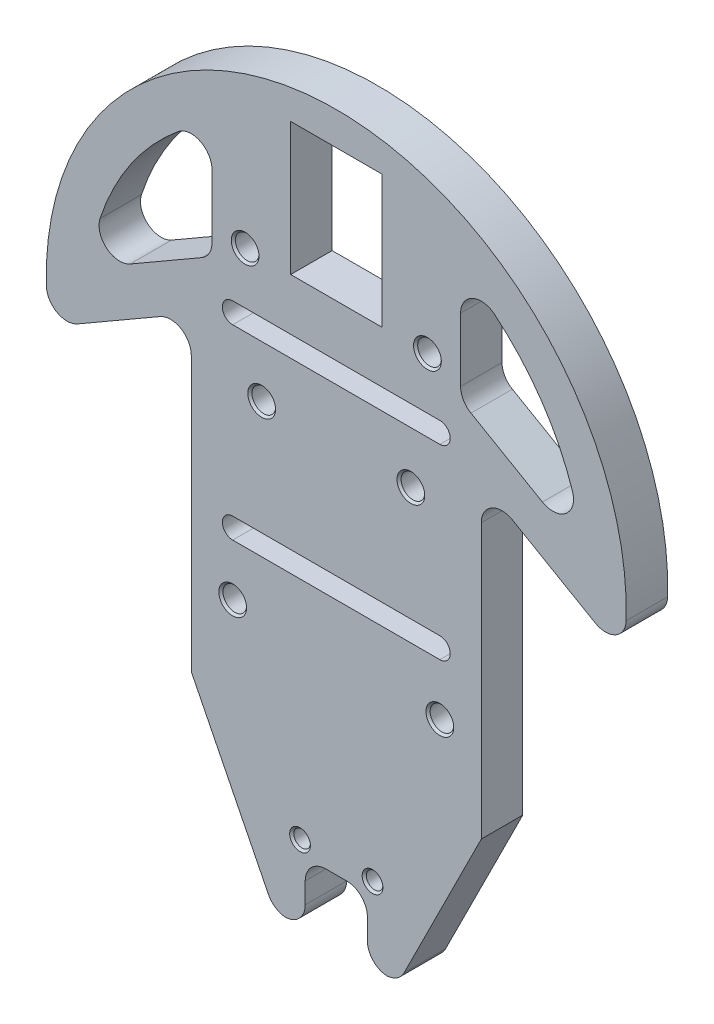
from build123d import *

# Parameters (mm, degrees)
SKETCH4_R           = 2
SKETCH4_R_2         = 2.85
SKETCH4_W           = 22
SKETCH4_H           = 32
BOSS_EXTRUDE1_DEPTH = 5
FILLET1_R           = 5
CHAMFER1_SIZE       = 0.5


with BuildPart() as part:
    # Sketch4 → Boss-Extrude1 (new, symmetric)
    with BuildSketch(Plane.XY):
        with BuildLine():
            ThreePointArc((69.282032303, -10), (0, 70), (-69.282032303, -10))
            Line((-69.282032303, -10), (-35, 9.792740578))
            Line((-35, 9.792740578), (-35, -55))
            Line((-35, -55), (-35, -65))
            Line((-35, -65), (-15, -105))
            Line((-15, -105), (-7.5, -105))
            Line((-7.5, -105), (-7.5, -90))
            Line((-7.5, -90), (7.5, -90))
            Line((7.5, -90), (7.5, -105))
            Line((7.5, -105), (15, -105))
            Line((15, -105), (35, -65))
            Line((35, -65), (35, 9.792740578))
            Line((35, 9.792740578), (69.282032303, -10))
        make_face()
        with Locations((-8.75, -87)):
            Circle(SKETCH4_R, mode=Mode.SUBTRACT)
        with Locations((-25, -45)):
            Circle(SKETCH4_R_2, mode=Mode.SUBTRACT)
        with Locations((8.75, -87)):
            Circle(SKETCH4_R, mode=Mode.SUBTRACT)
        with Locations((25, -45)):
            Circle(SKETCH4_R_2, mode=Mode.SUBTRACT)
        with BuildLine():
            Line((25, -32.5), (-25, -32.5))
            ThreePointArc((-25, -32.5), (-27.5, -30), (-25, -27.5))
            Line((-25, -27.5), (25, -27.5))
            ThreePointArc((25, -27.5), (27.5, -30), (25, -32.5))
        make_face(mode=Mode.SUBTRACT)
        with Locations((-18, 0)):
            Circle(SKETCH4_R_2, mode=Mode.SUBTRACT)
        with BuildLine():
            Line((-30, 24.226497308), (-59.572090597, 7.153042841))
            ThreePointArc((-59.572090597, 7.153042841), (-50.077338732, 33.04935923), (-30, 51.961524227))
            Line((-30, 51.961524227), (-30, 24.226497308))
        make_face(mode=Mode.SUBTRACT)
        with Locations((-22, 30)):
            Circle(SKETCH4_R_2, mode=Mode.SUBTRACT)
        with Locations((0, 46)):
            Rectangle(SKETCH4_W, SKETCH4_H, mode=Mode.SUBTRACT)
        with Locations((18, 0)):
            Circle(SKETCH4_R_2, mode=Mode.SUBTRACT)
        with BuildLine():
            Line((25, 12.5), (-25, 12.5))
            ThreePointArc((-25, 12.5), (-27.5, 15), (-25, 17.5))
            Line((-25, 17.5), (25, 17.5))
            ThreePointArc((25, 17.5), (27.5, 15), (25, 12.5))
        make_face(mode=Mode.SUBTRACT)
        with Locations((22, 30)):
            Circle(SKETCH4_R_2, mode=Mode.SUBTRACT)
        with BuildLine():
            Line((59.572090597, 7.153042841), (30, 24.226497308))
            Line((30, 24.226497308), (30, 51.961524227))
            ThreePointArc((30, 51.961524227), (50.077338732, 33.04935923), (59.572090597, 7.153042841))
        make_face(mode=Mode.SUBTRACT)
    extrude(amount=BOSS_EXTRUDE1_DEPTH, both=True)

    # Fillet1
    # the kernel refuses this fillet: 5 mm, written as the material it adds along each edge
    with BuildSketch(Plane(origin=(59.572090597, 7.153042841, -5), x_dir=(-0.8660254037844397, 0.49999999999999806, 0), z_dir=(0, 0, 1))) as fillet1_piece_1:
        with BuildLine():
            CenterArc((11.332313176, -5), FILLET1_R, 90, 138.168098297)
            ThreePointArc((7.997575975, -8.725523829), (3.783101322, -4.560454399), (0, 0))
            Line((0, 0), (11.332313176, 0))
        make_face()
    extrude(amount=10)
    with BuildSketch(Plane(origin=(30, 24.226497308, 5), x_dir=(0, 1, 0), z_dir=(0, 0, -1))) as fillet1_piece_2:
        with BuildLine():
            CenterArc((FILLET1_R * 0.57735026919, FILLET1_R), FILLET1_R, 210, 60)
            Line((-FILLET1_R * 0.288675134595, FILLET1_R * 0.5), (0, 0))
            Line((0, 0), (FILLET1_R * 0.57735026919, 0))
        make_face()
    extrude(amount=10)
    with BuildSketch(Plane(origin=(30, 51.961524227, -5), x_dir=(0, -1, 0), z_dir=(0, 0, 1))) as fillet1_piece_3:
        with BuildLine():
            CenterArc((9.535117356, 5), FILLET1_R, 140.478803641, 129.521196359)
            ThreePointArc((5.678171277, 8.181818182), (2.669034839, 4.208924127), (0, 0))
            Line((0, 0), (9.535117356, 0))
        make_face()
    extrude(amount=10)
    with BuildSketch(Plane(origin=(-59.572090597, 7.153042841, 5), x_dir=(0.2165677144201491, 0.9762675991094004, 0), z_dir=(0, 0, -1))) as fillet1_piece_4:
        with BuildLine():
            CenterArc((11.343039457, 4.975618333), FILLET1_R, 137.492482071, 138.168098297)
            Line((7.657096034, 8.354053043), (0, 0))
            ThreePointArc((0, 0), (5.918107543, -0.29258), (11.836215086, 0))
        make_face()
    extrude(amount=10)
    with BuildSketch(Plane(origin=(-30, 24.226497308, -5), x_dir=(-0.8660254037844397, -0.49999999999999795, 0), z_dir=(0, 0, 1))) as fillet1_piece_5:
        with BuildLine():
            CenterArc((FILLET1_R * 0.57735026919, -FILLET1_R), FILLET1_R, 90, 60)
            Line((-FILLET1_R * 0.288675134595, -FILLET1_R * 0.5), (0, 0))
            Line((0, 0), (FILLET1_R * 0.57735026919, 0))
        make_face()
    extrude(amount=10)
    with BuildSketch(Plane(origin=(-30, 51.961524227, -5), x_dir=(-0.8215414898046486, -0.5701487354450225, 0), z_dir=(0, 0, 1))) as fillet1_piece_6:
        with BuildLine():
            CenterArc((9.544142552, 4.982750841), FILLET1_R, 145.239401821, 129.521196359)
            Line((5.436435103, 7.833494518), (0, 0))
            ThreePointArc((0, 0), (4.979552636, -0.206989911), (9.959105271, 0))
        make_face()
    extrude(amount=10)
    with BuildSketch(Plane(origin=(35, 9.792740578, -5), x_dir=(0.8660254037844399, -0.49999999999999795, 0), z_dir=(0, 0, 1)), Plane(origin=(-35, 9.792740578, -5), x_dir=(0, -1, 0), z_dir=(0, 0, 1))) as fillet1_piece_7:
        with BuildLine():
            CenterArc((FILLET1_R * 1.73205080757, -FILLET1_R), FILLET1_R, 90, 120)
            Line((FILLET1_R * 0.866025403784, -FILLET1_R * 1.5), (0, 0))
            Line((0, 0), (FILLET1_R * 1.73205080757, 0))
        make_face()
    extrude(amount=10)
    with BuildSketch(Plane(origin=(7.5, -90, 5), x_dir=(0, -1, 0), z_dir=(0, 0, -1)), Plane(origin=(-7.5, -90, 5), x_dir=(1, 0, 0), z_dir=(0, 0, -1))) as fillet1_piece_8:
        with BuildLine():
            CenterArc((FILLET1_R, FILLET1_R), FILLET1_R, 180, 90)
            Line((0, FILLET1_R), (0, 0))
            Line((0, 0), (FILLET1_R, 0))
        make_face()
    extrude(amount=10)
    # the kernel refuses this fillet: 5 mm, written as the material it takes off along each edge
    with BuildSketch(Plane(origin=(-69.282032303, -10, -25.386938297), x_dir=(-0.08496362878818808, 0.9963840533565073, 0), z_dir=(0, 0, 1))) as fillet1_2_piece_1:
        with BuildLine():
            CenterArc((7.863533343, -4.991510604), FILLET1_R, 86.660722685, 118.465343928)
            Line((3.33665476, -7.114567433), (0, 0))
            ThreePointArc((0, 0), (4.077387659, 0.118851542), (8.154775319, 0))
        make_face()
    extrude(amount=50.773876593, mode=Mode.SUBTRACT)
    with BuildSketch(Plane(origin=(69.282032303, -10, -25.386938297), x_dir=(-0.8660254037844397, 0.4999999999999982, 0), z_dir=(0, 0, 1))) as fillet1_2_piece_2:
        with BuildLine():
            CenterArc((7.858138122, -5), FILLET1_R, 90, 118.465343928)
            ThreePointArc((3.462610285, -7.383135547), (1.623699843, -3.742033489), (0, 0))
            Line((0, 0), (7.858138122, 0))
        make_face()
    extrude(amount=50.773876593, mode=Mode.SUBTRACT)
    with BuildSketch(Plane(origin=(15, -105, -12.725424859), x_dir=(-1, 0, 0), z_dir=(0, 0, 1)), Plane(origin=(-15, -105, -12.725424859), x_dir=(-0.4472135954999598, 0.894427190999915, 0), z_dir=(0, 0, 1))) as fillet1_2_piece_3:
        with BuildLine():
            CenterArc((FILLET1_R * 0.61803398875, -FILLET1_R), FILLET1_R, 90, 63.434948823)
            Line((-FILLET1_R * 0.27639320225, -FILLET1_R * 0.5527864045), (0, 0))
            Line((0, 0), (FILLET1_R * 0.61803398875, 0))
        make_face()
    extrude(amount=25.450849719, mode=Mode.SUBTRACT)
    with BuildSketch(Plane(origin=(7.5, -105, -17.5), x_dir=(0, 1, 0), z_dir=(0, 0, 1))) as fillet1_2_piece_4:
        with BuildLine():
            CenterArc((FILLET1_R, -FILLET1_R), FILLET1_R, 90, 90)
            Line((0, -FILLET1_R), (0, 0))
            Line((0, 0), (FILLET1_R, 0))
        make_face()
    extrude(amount=35, mode=Mode.SUBTRACT)
    with BuildSketch(Plane(origin=(-7.5, -105, 17.5), x_dir=(-1, 0, 0), z_dir=(0, 0, -1))) as fillet1_2_piece_5:
        with BuildLine():
            CenterArc((FILLET1_R, FILLET1_R), FILLET1_R, 180, 90)
            Line((0, FILLET1_R), (0, 0))
            Line((0, 0), (FILLET1_R, 0))
        make_face()
    extrude(amount=35, mode=Mode.SUBTRACT)

    # Chamfer1
    chamfer1_edges = [part.edges().sort_by_distance(p)[0] for p in [
        (22.15, -45, 5),
        (19.15, 30, 5),
        (15.15, 0, 5),
        (6.75, -87, 5),
        (-10.75, -87, 5),
        (-24.85, 30, 5),
        (-20.85, 0, 5),
        (-27.85, -45, 5),
    ]]
    chamfer(chamfer1_edges, length=CHAMFER1_SIZE)


solid = part.part
